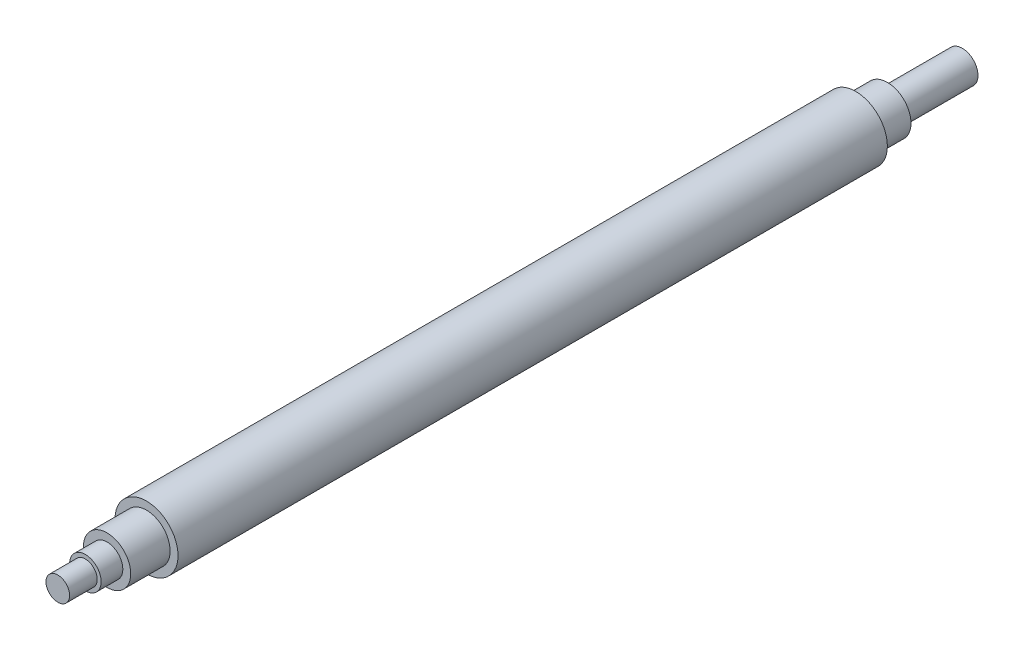
from build123d import *


with BuildPart() as part:
    # Schizzo2 → Rivoluzione2 (revolve)
    with BuildSketch(Plane(origin=(0, 0, 0), x_dir=(0, 0, -1), z_dir=(1, 0, 0))):
        Polygon((1.5, 0), (1.5, 3), (8.5, 3), (8.5, 4), (14, 4), (14, 6), (24, 6), (24, 8), (204, 8), (204, 6), (212, 6), (212, 4), (231, 4), (231, 0), align=None)
    revolve(axis=Axis((0, 0, 0), (0, 0, -1)))


solid = part.part
